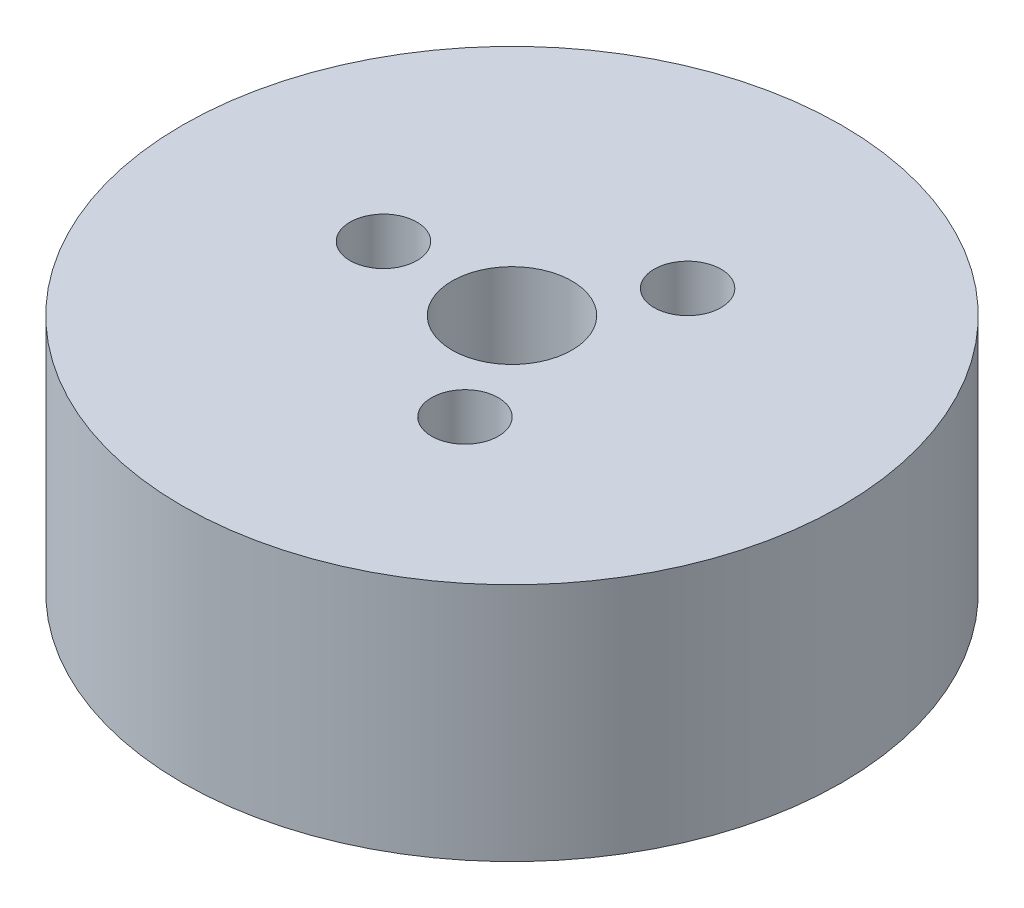
from build123d import *

# Parameters (mm, degrees)
SKETCH1_R           = 27.5
BOSS_EXTRUDE1_DEPTH = 20
SKETCH2_R           = 5
CUT_EXTRUDE1_DEPTH  = 44.732139211
SKETCH3_R           = 2.787571389
CUT_EXTRUDE2_DEPTH  = 16.919621254
CIRPATTERN1_COUNT   = 3


with BuildPart() as part:
    # Sketch1 → Boss-Extrude1 (new body)
    with BuildSketch(Plane(origin=(0, 0, 0), x_dir=(1, 0, 0), z_dir=(0, 1, 0))):
        Circle(SKETCH1_R)
    extrude(amount=BOSS_EXTRUDE1_DEPTH)

    # Sketch2 → Cut-Extrude1 (cut, through all)
    with BuildSketch(Plane(origin=(0, 0, 0), x_dir=(1, 0, 0), z_dir=(0, 1, 0))):
        Circle(SKETCH2_R)
    extrude(amount=CUT_EXTRUDE1_DEPTH, mode=Mode.SUBTRACT)

    # Sketch3 → Cut-Extrude2 (cut)
    with BuildSketch(Plane(origin=(0, 20, 0), x_dir=(1, 0, 0), z_dir=(0, 1, 0))):
        with Locations((-10.721186866, 0)):
            Circle(SKETCH3_R)
    cut_extrude2 = extrude(amount=-CUT_EXTRUDE2_DEPTH, mode=Mode.SUBTRACT)

    # CirPattern1: Cut-Extrude2 ×3 about axis
    cirpattern1_axis = Axis((0, 0, 0), (0, 1, 0))
    for i in range(1, CIRPATTERN1_COUNT):
        add(cut_extrude2.rotate(cirpattern1_axis, i * 360 / CIRPATTERN1_COUNT), mode=Mode.SUBTRACT)


solid = part.part
